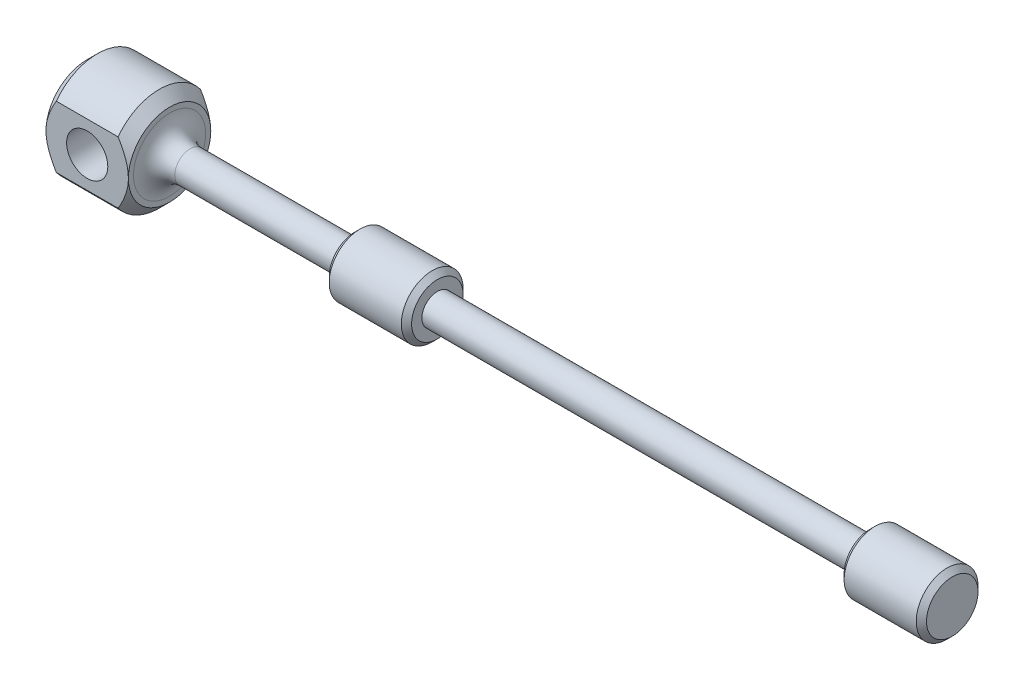
from build123d import *

# Parameters (mm, degrees)
SKETCH1_R           = 1.5
BOSS_EXTRUDE1_DEPTH = 38
SKETCH2_R           = 3
BOSS_EXTRUDE2_DEPTH = 8
BOSS_EXTRUDE3_START = -50
SKETCH2_2_R         = 3
BOSS_EXTRUDE3_DEPTH = 8
CHAMFER1_SIZE       = 0.5
SKETCH3_R           = 5
BOSS_EXTRUDE4_DEPTH = 8
CUT_EXTRUDE1_DEPTH  = 8
SKETCH5_R           = 2
CUT_EXTRUDE2_DEPTH  = 47.957427527
CHAMFER3_SIZE       = 1
FILLET1_R           = 2
CHAMFER4_SIZE       = 1


with BuildPart() as part:
    # Sketch1 → Boss-Extrude1 (new, symmetric)
    with BuildSketch(Plane(origin=(0, 0, 0), x_dir=(0, 0, -1), z_dir=(1, 0, 0))):
        Circle(SKETCH1_R)
    extrude(amount=BOSS_EXTRUDE1_DEPTH, both=True)

    # Sketch2 → Boss-Extrude2 (add)
    with BuildSketch(Plane(origin=(38, 0, 0), x_dir=(0, 0, -1), z_dir=(1, 0, 0))):
        Circle(SKETCH2_R)
    extrude(amount=BOSS_EXTRUDE2_DEPTH)

    # Sketch2<2> → Boss-Extrude3 (add)
    with BuildSketch(Plane(origin=(38, 0, 0), x_dir=(0, 0, -1), z_dir=(1, 0, 0)).offset(BOSS_EXTRUDE3_START)):
        Circle(SKETCH2_2_R)
    extrude(amount=BOSS_EXTRUDE3_DEPTH)

    # Chamfer1
    chamfer1_edges = [part.edges().sort_by_distance(p)[0] for p in [
        (-12, 0, 3),
        (-4, 0, 3),
        (38, 0, 3),
        (46, 0, 3),
    ]]
    chamfer(chamfer1_edges, length=CHAMFER1_SIZE)

    # Sketch3 → Boss-Extrude4 (add)
    with BuildSketch(Plane.ZY.offset(38)):
        Circle(SKETCH3_R)
    extrude(amount=-BOSS_EXTRUDE4_DEPTH)

    # Sketch4 → Cut-Extrude1 (cut)
    with BuildSketch(Plane.ZY.offset(38)):
        with BuildLine():
            Line((-4, 3), (-4, -3))
            ThreePointArc((-4, -3), (-5, 0), (-4, 3))
        make_face()
        with BuildLine():
            Line((4, 3), (4, -3))
            ThreePointArc((4, -3), (5, 0), (4, 3))
        make_face()
    extrude(amount=-CUT_EXTRUDE1_DEPTH, mode=Mode.SUBTRACT)

    # Sketch5 → Cut-Extrude2 (cut, through all)
    with BuildSketch(Plane.XY.offset(4)):
        with Locations((-34, 0)):
            Circle(SKETCH5_R)
    extrude(amount=-CUT_EXTRUDE2_DEPTH, mode=Mode.SUBTRACT)

    # Chamfer3
    chamfer3_edges = [part.edges().sort_by_distance(p)[0] for p in [
        (-38, 5, 0),
        (-38, -5, 0),
    ]]
    chamfer(chamfer3_edges, length=CHAMFER3_SIZE - 0.0001)  # a hair under: the kernel refuses the full size

    # Fillet1
    fillet1_edges = [part.edges().sort_by_distance(p)[0] for p in [
        (-30, 0, 1.5),
    ]]
    fillet(fillet1_edges, radius=FILLET1_R)

    # Chamfer4
    chamfer4_edges = [part.edges().sort_by_distance(p)[0] for p in [
        (-30, 5, 0),
        (-30, -5, 0),
    ]]
    chamfer(chamfer4_edges, length=CHAMFER4_SIZE - 0.0001)  # a hair under: the kernel refuses the full size


solid = part.part
